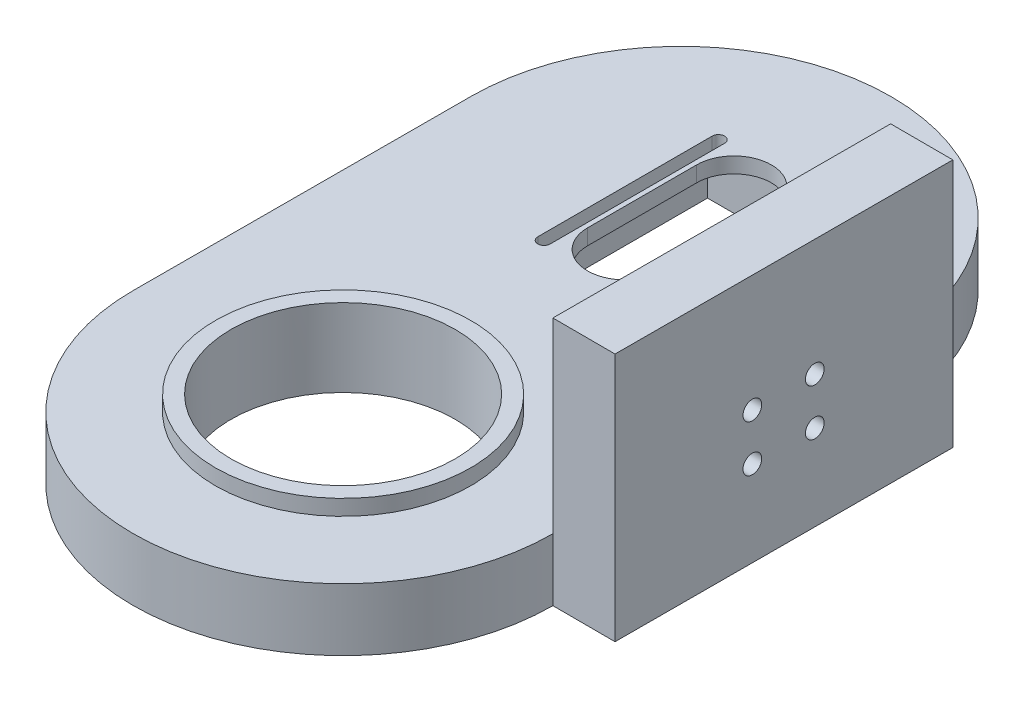
from build123d import *

# Parameters (mm, degrees)
BOSS_EXTRUDE1_DEPTH = 20
SKETCH8_W           = 42
SKETCH8_H           = 60
CUT_EXTRUDE1_DEPTH  = 15
CUT_EXTRUDE2_START  = -5
CUT_EXTRUDE2_DEPTH  = 5
SKETCH10_R          = 36
CUT_EXTRUDE3_DEPTH  = 159.144630057
SKETCH11_R          = 41
SKETCH11_R_2        = 36
BOSS_EXTRUDE4_DEPTH = 5
SKETCH2_W           = 108.205781707
SKETCH2_H           = 80
SKETCH2_R           = 3
BOSS_EXTRUDE6_DEPTH = 20


# Read off the part's stored shape, not the designer's step: Cut-Extrude2
with BuildPart() as part:
    # Sketch1 → Boss-Extrude1 (new body)
    with BuildSketch(Plane(origin=(0, 0, 0), x_dir=(1, 0, 0), z_dir=(0, 1, 0))):
        with BuildLine():
            Line((47.743715131, 62.553367624), (47.499828545, -45.652139232))
            ThreePointArc((47.499828545, -45.652139232), (-20.152139232, -112.999828545), (-87.499828545, -45.347860768))
            Line((-87.499828545, -45.347860768), (-87.25594196, 62.857646088))
            ThreePointArc((-87.25594196, 62.857646088), (-19.603974182, 130.205335402), (47.743715131, 62.553367624))
        make_face()
    extrude(amount=BOSS_EXTRUDE1_DEPTH)

    # Sketch8 → Cut-Extrude1 (cut)
    with BuildSketch(Plane.XZ):
        with Locations((-20, -62.5)):
            Rectangle(SKETCH8_W, SKETCH8_H)
    extrude(amount=-CUT_EXTRUDE1_DEPTH, mode=Mode.SUBTRACT)

    # Cut-Extrude2 outline → Cut-Extrude2 (cut)
    with BuildSketch(Plane.XZ.offset(-15).offset(CUT_EXTRUDE2_START)):
        with BuildLine():
            Line((-6.5, -34.5), (-6.5, -90.5))
            ThreePointArc((-6.5, -90.5), (-4.5, -92.5), (-2.5, -90.5))
            Line((-2.5, -90.5), (-2.5, -34.5))
            ThreePointArc((-2.5, -34.5), (-4.5, -32.5), (-6.5, -34.5))
        make_face()
        with BuildLine():
            ThreePointArc((-8, -45), (-20, -33), (-32, -45))
            Line((-32, -45), (-32, -80))
            ThreePointArc((-32, -80), (-20, -92), (-8, -80))
            Line((-8, -80), (-8, -45))
        make_face()
        with BuildLine():
            Line((-37.5, -34.5), (-37.5, -90.5))
            ThreePointArc((-37.5, -90.5), (-35.5, -92.5), (-33.5, -90.5))
            Line((-33.5, -90.5), (-33.5, -34.5))
            ThreePointArc((-33.5, -34.5), (-35.5, -32.5), (-37.5, -34.5))
        make_face()
    extrude(amount=CUT_EXTRUDE2_DEPTH, mode=Mode.SUBTRACT)

    # Sketch10 → Cut-Extrude3 (cut, through all)
    with BuildSketch(Plane.XZ):
        with Locations(Location((-20, 45.5, 0), (0, 0, 270))):
            Circle(SKETCH10_R)
    extrude(amount=-CUT_EXTRUDE3_DEPTH, mode=Mode.SUBTRACT)

    # Sketch11 → Boss-Extrude4 (add)
    with BuildSketch(Plane(origin=(0, 20, 0), x_dir=(1, 0, 0), z_dir=(0, 1, 0))):
        with Locations(Location((-20, -45.5, 0), (0, 0, 270))):
            Circle(SKETCH11_R)
        with Locations(Location((-20, -45.5, 0), (0, 0, 90))):
            Circle(SKETCH11_R_2, mode=Mode.SUBTRACT)
    extrude(amount=BOSS_EXTRUDE4_DEPTH)

    # Sketch2 → Boss-Extrude6 (add)
    with BuildSketch(Plane(origin=(47.602482999, 0, 0.107292202), x_dir=(0.002253914548687051, 0, -0.9999974599313777), z_dir=(0.9999974599313777, 0, 0.002253914548687051))):
        with Locations((8.557928136, 40)):
            Rectangle(SKETCH2_W, SKETCH2_H)
        with Locations((-1.551375347, 27.5)):
            Circle(SKETCH2_R, mode=Mode.SUBTRACT)
        with Locations((18.448624653, 27.5)):
            Circle(SKETCH2_R, mode=Mode.SUBTRACT)
        with Locations((18.448624653, 42.5)):
            Circle(SKETCH2_R, mode=Mode.SUBTRACT)
        with Locations((-1.551375347, 42.5)):
            Circle(SKETCH2_R, mode=Mode.SUBTRACT)
    extrude(amount=BOSS_EXTRUDE6_DEPTH)


solid = part.part
